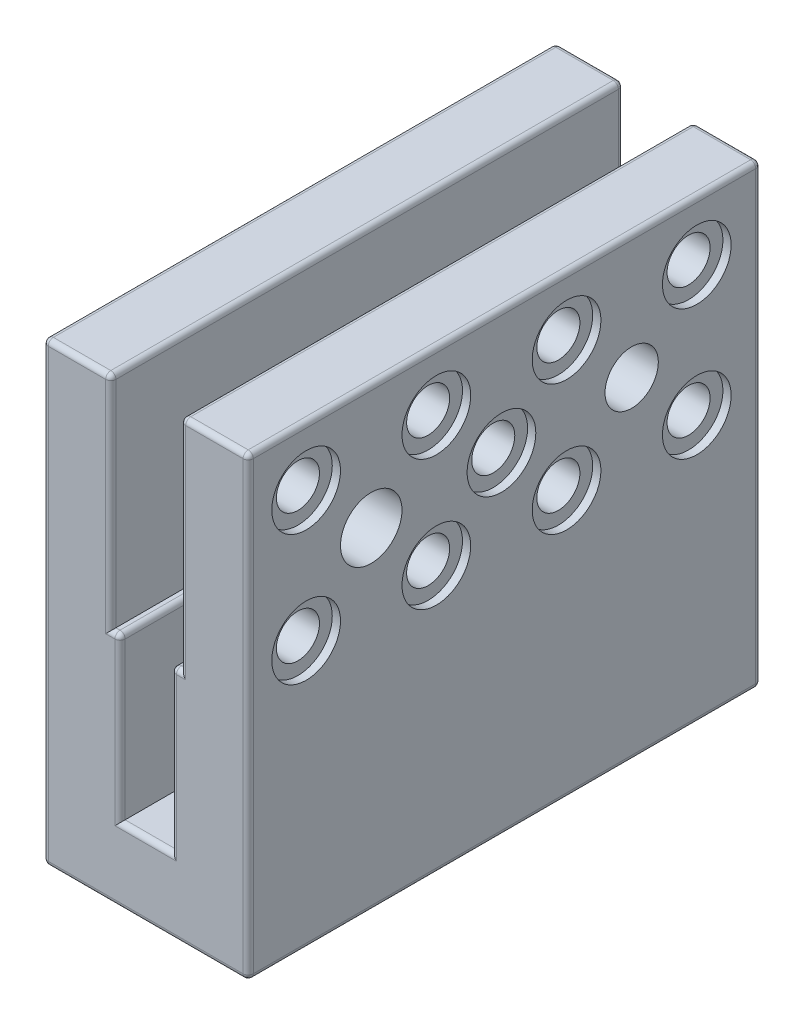
from build123d import *

# Parameters (mm, degrees)
SKETCH2_W           = 20
SKETCH2_H           = 50
BOSS_EXTRUDE1_DEPTH = 44.5
SKETCH3_W           = 6.8
SKETCH3_H           = 21.48
SKETCH3_W_2         = 5
SKETCH3_H_2         = 15.77
CUT_EXTRUDE3_DEPTH  = 68.677544282
SKETCH4_R           = 3
SKETCH4_R_2         = 2.6
CUT_EXTRUDE4_DEPTH  = 55.820160525
CUT_EXTRUDE5_REACH  = 56.82
SKETCH4_3_R         = 2.1
BOSS_EXTRUDE2_START = -6.6
SKETCH5_R           = 3
SKETCH5_R_2         = 2.6
BOSS_EXTRUDE2_DEPTH = 6.6
SKETCH6_R           = 3.1
CUT_EXTRUDE6_DEPTH  = 1.23
SKETCH7_W           = 4.6
SKETCH7_H           = 20.1
CUT_EXTRUDE7_DEPTH  = 3.25
FILLET1_R           = 0.5
SKETCH8_R           = 3.35
CUT_EXTRUDE8_DEPTH  = 0.8


with BuildPart() as part:
    # Sketch2 → Boss-Extrude1 (new body)
    with BuildSketch(Plane(origin=(0, 0, 0), x_dir=(1, 0, 0), z_dir=(0, 1, 0))):
        Rectangle(SKETCH2_W, SKETCH2_H)
    extrude(amount=BOSS_EXTRUDE1_DEPTH)

    # Sketch3 → Cut-Extrude3 (cut, through all)
    with BuildSketch(Plane.XY.offset(25)):
        with Locations((0, 33.76)):
            Rectangle(SKETCH3_W, SKETCH3_H)
        with Locations((0, 15.135)):
            Rectangle(SKETCH3_W_2, SKETCH3_H_2)
    extrude(amount=-CUT_EXTRUDE3_DEPTH, mode=Mode.SUBTRACT)

    # Sketch4 → Cut-Extrude4 (cut, through all)
    with BuildSketch(Plane(origin=(10, 0, 0), x_dir=(0, 0, -1), z_dir=(1, 0, 0))):
        with Locations((-13, 32.41)):
            Circle(SKETCH4_R)
        with Locations((12.4, 32.41)):
            Circle(SKETCH4_R_2)
    extrude(amount=-CUT_EXTRUDE4_DEPTH, mode=Mode.SUBTRACT)

    # Sketch4<3> → Cut-Extrude5 (cut, up to next)
    with BuildSketch(Plane(origin=(10, 0, 0), x_dir=(0, 0, -1), z_dir=(1, 0, 0)), mode=Mode.PRIVATE) as cut_extrude5_sk1:
        with Locations((-0.3, 32.41)):
            Circle(SKETCH4_3_R)
    cut_extrude5_tool1 = extrude(cut_extrude5_sk1.sketch, amount=-CUT_EXTRUDE5_REACH, mode=Mode.PRIVATE) & part.part
    # Sketch4<3> → Cut-Extrude5 (cut, up to next)
    with BuildSketch(Plane(origin=(10, 0, 0), x_dir=(0, 0, -1), z_dir=(1, 0, 0)), mode=Mode.PRIVATE) as cut_extrude5_sk2:
        with Locations((-19.35, 38.76)):
            Circle(SKETCH4_3_R)
    cut_extrude5_tool2 = extrude(cut_extrude5_sk2.sketch, amount=-CUT_EXTRUDE5_REACH, mode=Mode.PRIVATE) & part.part
    # Sketch4<3> → Cut-Extrude5 (cut, up to next)
    with BuildSketch(Plane(origin=(10, 0, 0), x_dir=(0, 0, -1), z_dir=(1, 0, 0)), mode=Mode.PRIVATE) as cut_extrude5_sk3:
        with Locations((-6.65, 38.76)):
            Circle(SKETCH4_3_R)
    cut_extrude5_tool3 = extrude(cut_extrude5_sk3.sketch, amount=-CUT_EXTRUDE5_REACH, mode=Mode.PRIVATE) & part.part
    # Sketch4<3> → Cut-Extrude5 (cut, up to next)
    with BuildSketch(Plane(origin=(10, 0, 0), x_dir=(0, 0, -1), z_dir=(1, 0, 0)), mode=Mode.PRIVATE) as cut_extrude5_sk4:
        with Locations((6.05, 38.76)):
            Circle(SKETCH4_3_R)
    cut_extrude5_tool4 = extrude(cut_extrude5_sk4.sketch, amount=-CUT_EXTRUDE5_REACH, mode=Mode.PRIVATE) & part.part
    # Sketch4<3> → Cut-Extrude5 (cut, up to next)
    with BuildSketch(Plane(origin=(10, 0, 0), x_dir=(0, 0, -1), z_dir=(1, 0, 0)), mode=Mode.PRIVATE) as cut_extrude5_sk5:
        with Locations((18.75, 38.76)):
            Circle(SKETCH4_3_R)
    cut_extrude5_tool5 = extrude(cut_extrude5_sk5.sketch, amount=-CUT_EXTRUDE5_REACH, mode=Mode.PRIVATE) & part.part
    # Sketch4<3> → Cut-Extrude5 (cut, up to next)
    with BuildSketch(Plane(origin=(10, 0, 0), x_dir=(0, 0, -1), z_dir=(1, 0, 0)), mode=Mode.PRIVATE) as cut_extrude5_sk6:
        with Locations((18.75, 26.06)):
            Circle(SKETCH4_3_R)
    cut_extrude5_tool6 = extrude(cut_extrude5_sk6.sketch, amount=-CUT_EXTRUDE5_REACH, mode=Mode.PRIVATE) & part.part
    # Sketch4<3> → Cut-Extrude5 (cut, up to next)
    with BuildSketch(Plane(origin=(10, 0, 0), x_dir=(0, 0, -1), z_dir=(1, 0, 0)), mode=Mode.PRIVATE) as cut_extrude5_sk7:
        with Locations((6.05, 26.06)):
            Circle(SKETCH4_3_R)
    cut_extrude5_tool7 = extrude(cut_extrude5_sk7.sketch, amount=-CUT_EXTRUDE5_REACH, mode=Mode.PRIVATE) & part.part
    # Sketch4<3> → Cut-Extrude5 (cut, up to next)
    with BuildSketch(Plane(origin=(10, 0, 0), x_dir=(0, 0, -1), z_dir=(1, 0, 0)), mode=Mode.PRIVATE) as cut_extrude5_sk8:
        with Locations((-6.65, 26.06)):
            Circle(SKETCH4_3_R)
    cut_extrude5_tool8 = extrude(cut_extrude5_sk8.sketch, amount=-CUT_EXTRUDE5_REACH, mode=Mode.PRIVATE) & part.part
    # Sketch4<3> → Cut-Extrude5 (cut, up to next)
    with BuildSketch(Plane(origin=(10, 0, 0), x_dir=(0, 0, -1), z_dir=(1, 0, 0)), mode=Mode.PRIVATE) as cut_extrude5_sk9:
        with Locations((-19.35, 26.06)):
            Circle(SKETCH4_3_R)
    cut_extrude5_tool9 = extrude(cut_extrude5_sk9.sketch, amount=-CUT_EXTRUDE5_REACH, mode=Mode.PRIVATE) & part.part
    add(cut_extrude5_tool1.solids().sort_by_distance((10, 32.41, 0.3))[0], mode=Mode.SUBTRACT)
    add(cut_extrude5_tool2.solids().sort_by_distance((10, 38.76, 19.35))[0], mode=Mode.SUBTRACT)
    add(cut_extrude5_tool3.solids().sort_by_distance((10, 38.76, 6.65))[0], mode=Mode.SUBTRACT)
    add(cut_extrude5_tool4.solids().sort_by_distance((10, 38.76, -6.05))[0], mode=Mode.SUBTRACT)
    add(cut_extrude5_tool5.solids().sort_by_distance((10, 38.76, -18.75))[0], mode=Mode.SUBTRACT)
    add(cut_extrude5_tool6.solids().sort_by_distance((10, 26.06, -18.75))[0], mode=Mode.SUBTRACT)
    add(cut_extrude5_tool7.solids().sort_by_distance((10, 26.06, -6.05))[0], mode=Mode.SUBTRACT)
    add(cut_extrude5_tool8.solids().sort_by_distance((10, 26.06, 6.65))[0], mode=Mode.SUBTRACT)
    add(cut_extrude5_tool9.solids().sort_by_distance((10, 26.06, 19.35))[0], mode=Mode.SUBTRACT)

    # Sketch5 → Boss-Extrude2 (add)
    with BuildSketch(Plane.ZY.offset(10).offset(BOSS_EXTRUDE2_START)):
        with Locations((13, 32.41)):
            Circle(SKETCH5_R)
        with Locations((13, 32.41)):
            Circle(SKETCH5_R_2, mode=Mode.SUBTRACT)
    extrude(amount=BOSS_EXTRUDE2_DEPTH)

    # Sketch6 → Cut-Extrude6 (cut)
    with BuildSketch(Plane.ZY.offset(-3.4)):
        with Locations((-18.75, 26.06)):
            Circle(SKETCH6_R)
        with Locations((-18.75, 38.76)):
            Circle(SKETCH6_R)
        with Locations((-6.05, 38.76)):
            Circle(SKETCH6_R)
        with Locations((6.65, 38.76)):
            Circle(SKETCH6_R)
        with Locations((0.3, 32.41)):
            Circle(SKETCH6_R)
        with Locations((-6.05, 26.06)):
            Circle(SKETCH6_R)
        with Locations((6.65, 26.06)):
            Circle(SKETCH6_R)
        with Locations((19.35, 26.06)):
            Circle(SKETCH6_R)
        with Locations((19.35, 38.76)):
            Circle(SKETCH6_R)
    extrude(amount=-CUT_EXTRUDE6_DEPTH, mode=Mode.SUBTRACT)

    # Sketch7 → Cut-Extrude7 (cut)
    with BuildSketch(Plane.ZY.offset(10)):
        with Locations((-16.3, 13.53)):
            Rectangle(SKETCH7_W, SKETCH7_H)
    extrude(amount=-CUT_EXTRUDE7_DEPTH, mode=Mode.SUBTRACT)

    # Fillet1
    fillet1_edges = [part.edges().sort_by_distance(p)[0] for p in [
        (-10, 0, 0),
        (10, 0, 0),
        (-10, 22.25, -25),
        (0, 0, -25),
        (10, 22.25, -25),
        (3.4, 33.76, -25),
        (2.95, 23.02, -25),
        (2.5, 15.135, -25),
        (0, 7.25, -25),
        (-2.5, 15.135, -25),
        (-2.95, 23.02, -25),
        (-3.4, 33.76, -25),
        (-2.5, 15.135, 25),
        (0, 7.25, 25),
        (2.5, 15.135, 25),
        (2.95, 23.02, 25),
        (3.4, 33.76, 25),
        (10, 22.25, 25),
        (0, 0, 25),
        (-10, 22.25, 25),
        (-3.4, 33.76, 25),
        (-2.95, 23.02, 25),
        (10, 44.5, 0),
        (6.7, 44.5, 25),
        (3.4, 44.5, 0),
        (6.7, 44.5, -25),
        (-6.7, 44.5, 25),
        (-10, 44.5, 0),
        (-6.7, 44.5, -25),
        (-3.4, 44.5, 0),
        (2.5, 23.02, 0),
        (-2.5, 23.02, 0),
    ]]
    fillet(fillet1_edges, radius=FILLET1_R)

    # Sketch8 → Cut-Extrude8 (cut)
    with BuildSketch(Plane(origin=(10, 0, 0), x_dir=(0, 0, -1), z_dir=(1, 0, 0))):
        with Locations((-19.35, 38.76)):
            Circle(SKETCH8_R)
        with Locations((-6.65, 38.76)):
            Circle(SKETCH8_R)
        with Locations((6.05, 38.76)):
            Circle(SKETCH8_R)
        with Locations((18.75, 38.76)):
            Circle(SKETCH8_R)
        with Locations((-0.3, 32.41)):
            Circle(SKETCH8_R)
        with Locations((-19.35, 26.06)):
            Circle(SKETCH8_R)
        with Locations((-6.65, 26.06)):
            Circle(SKETCH8_R)
        with Locations((6.05, 26.06)):
            Circle(SKETCH8_R)
        with Locations((18.75, 26.06)):
            Circle(SKETCH8_R)
    extrude(amount=-CUT_EXTRUDE8_DEPTH, mode=Mode.SUBTRACT)


solid = part.part
